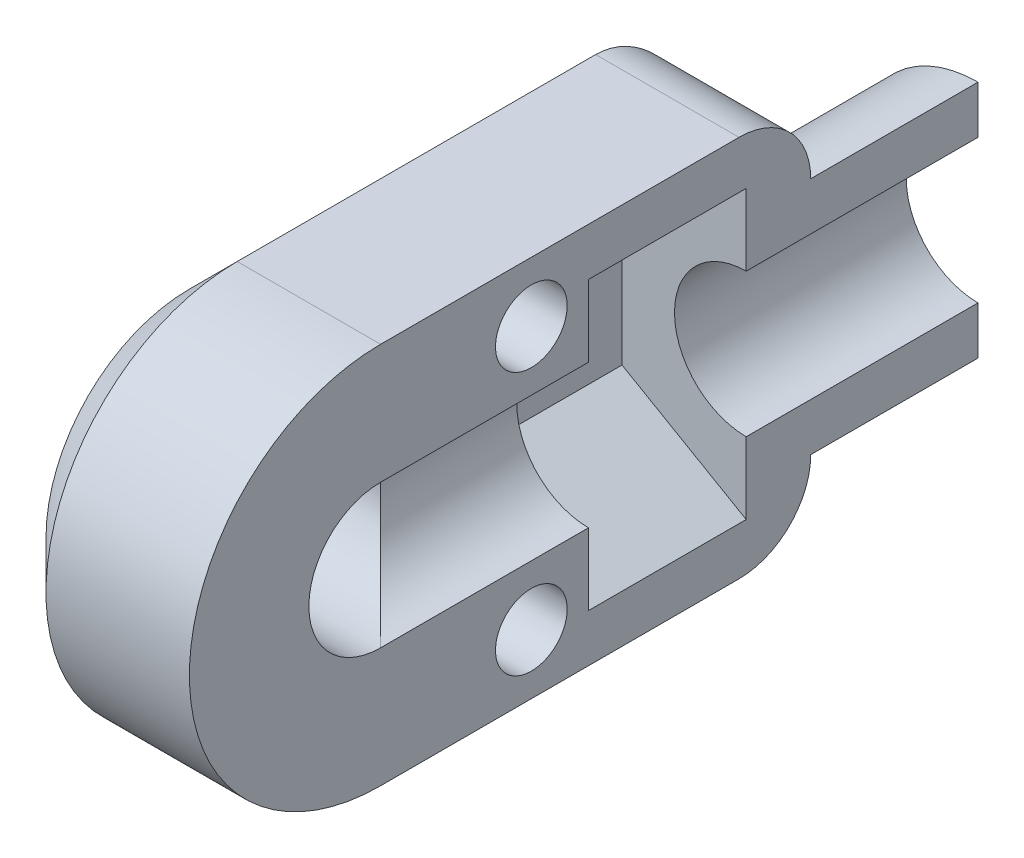
from build123d import *

# Parameters (mm, degrees)
BOSS_EXTRUDE1_DEPTH          = 16
CHAMFER2_SIZE                = 2
ENL_V_MAT_EXTRU_1_REACH      = 39.537
ENL_V_MAT_EXTRU_1_END_RADIUS = 3
ESQUISSE1_R                  = 3
ESQUISSE2_W                  = 9.751627811
ESQUISSE2_H                  = 34.282380126
ENL_V_MAT_EXTRU_2_DEPTH      = 56
ENL_V_MAT_EXTRU_3_DEPTH      = 3.3
ENL_V_MAT_EXTRU_3_DEPTH_BACK = 3.3
ESQUISSE8_R                  = 1.5
ENL_V_MAT_EXTRU_4_DEPTH      = 10.3
ESQUISSE9_R                  = 2
ENL_V_MAT_EXTRU_5_DEPTH      = 2
ENL_V_MAT_EXTRU_6_DEPTH      = 7
CONG_1_R                     = 3


with BuildPart() as part:
    # Sketch1 → Boss-Extrude1 (new body)
    with BuildSketch(Plane(origin=(0, 0, 0), x_dir=(0, -1, 0), z_dir=(1, 0, 0))):
        with BuildLine():
            ThreePointArc((-8, 0), (0, 8), (8, 0))
            Line((8, 0), (8, 25))
            Line((8, 25), (-8, 25))
            Line((-8, 25), (-8, 0))
        make_face()
        with BuildLine():
            ThreePointArc((-3, 0), (0, 3), (3, 0))
            Line((3, 0), (8, 0))
            ThreePointArc((8, 0), (0, 8), (-8, 0))
            Line((-8, 0), (-3, 0))
        make_face()
        with BuildLine():
            Line((8, 0), (3, 0))
            ThreePointArc((3, 0), (0, -3), (-3, 0))
            Line((-3, 0), (-8, 0))
            ThreePointArc((-8, 0), (0, -8), (8, 0))
        make_face()
    extrude(amount=BOSS_EXTRUDE1_DEPTH)

    # Chamfer2
    chamfer2_edges = [part.edges().sort_by_distance(p)[0] for p in [
        (16, 8, -12.5),
        (16, 0, 8),
        (0, 8, -12.5),
        (0, -8, -12.5),
        (0, 0, 8),
        (16, -8, -12.5),
    ]]
    chamfer(chamfer2_edges, length=CHAMFER2_SIZE)

    # Enlèv. mat.-Extru.1: up to this cylinder (the profile starts outside it)
    enl_v_mat_extru_1_end = Plane(origin=(8, 0, 0), z_dir=(-1, 0, 0)) * Cylinder(ENL_V_MAT_EXTRU_1_END_RADIUS, 86.074, mode=Mode.PRIVATE)
    # Esquisse1 → Enlèv. mat.-Extru.1 (cut, up to the surface)
    with BuildSketch(Plane(origin=(0, 0, -25), x_dir=(-1, 0, 0), z_dir=(0, 0, -1)), mode=Mode.PRIVATE) as enl_v_mat_extru_1_sk1:
        with Locations((-8, 0)):
            Circle(ESQUISSE1_R)
    enl_v_mat_extru_1_tool1 = extrude(enl_v_mat_extru_1_sk1.sketch, amount=-ENL_V_MAT_EXTRU_1_REACH, mode=Mode.PRIVATE) - enl_v_mat_extru_1_end
    add(enl_v_mat_extru_1_tool1.solids().sort_by_distance((8, 0, -25))[0], mode=Mode.SUBTRACT)

    # Esquisse2 → Enlèv. mat.-Extru.2 (cut)
    with BuildSketch(Plane(origin=(0, 8, 0), x_dir=(1, 0, 0), z_dir=(0, 1, 0))):
        with Locations((12.875813906, 7.858809937)):
            Rectangle(ESQUISSE2_W, ESQUISSE2_H)
    extrude(amount=-ENL_V_MAT_EXTRU_2_DEPTH, mode=Mode.SUBTRACT)

    # Esquisse4 → Enlèv. mat.-Extru.3 (cut, two sides: drawn at the far end of the back side and taken through both)
    with BuildSketch(Plane.XY.offset(-12).offset(-ENL_V_MAT_EXTRU_3_DEPTH_BACK)):
        Polygon((13.196152423, -3), (13.196152423, 3), (8, 6), (2.803847577, 3), (2.803847577, -3), (8, -6), align=None)
    extrude(amount=ENL_V_MAT_EXTRU_3_DEPTH + ENL_V_MAT_EXTRU_3_DEPTH_BACK, mode=Mode.SUBTRACT)

    # Esquisse8 → Enlèv. mat.-Extru.4 (cut)
    with BuildSketch(Plane(origin=(8, 0, 0), x_dir=(0, 0, -1), z_dir=(1, 0, 0))):
        with Locations((6.308944807, 5.5)):
            Circle(ESQUISSE8_R)
        with Locations(Location((6.308944807, -5.5, 0), (0, 0, 340.528779366))):
            Circle(ESQUISSE8_R)
    extrude(amount=-ENL_V_MAT_EXTRU_4_DEPTH, mode=Mode.SUBTRACT)

    # Esquisse9 → Enlèv. mat.-Extru.5 (cut)
    with BuildSketch(Plane.ZY):
        with Locations((-6.308944807, 5.5)):
            Circle(ESQUISSE9_R)
        with Locations(Location((-6.308944807, -5.5, 0), (0, 0, 345.522487814))):
            Circle(ESQUISSE9_R)
    extrude(amount=-ENL_V_MAT_EXTRU_5_DEPTH, mode=Mode.SUBTRACT)

    # Esquisse10 → Enlèv. mat.-Extru.6 (cut)
    with BuildSketch(Plane(origin=(0, 0, -25), x_dir=(-1, 0, 0), z_dir=(0, 0, -1))):
        with BuildLine():
            Line((-8, 8), (-8, 5))
            ThreePointArc((-8, 5), (-3, 0), (-8, -5))
            Line((-8, -5), (-8, -5.041535343))
            Line((-8, -5.041535343), (-8, -8))
            Line((-8, -8), (-2, -8))
            Line((-2, -8), (0, -6))
            Line((0, -6), (0, 6))
            Line((0, 6), (-2, 8))
            Line((-2, 8), (-8, 8))
        make_face()
    extrude(amount=-ENL_V_MAT_EXTRU_6_DEPTH, mode=Mode.SUBTRACT)

    # Congé1
    cong_1_edges = [part.edges().sort_by_distance(p)[0] for p in [
        (5, -8, -18),
        (1, -7, -18),
        (0, 0, -18),
        (1, 7, -18),
        (5, 8, -18),
    ]]
    fillet(cong_1_edges, radius=CONG_1_R - 0.0001)  # a hair under: the kernel refuses the full size


solid = part.part
